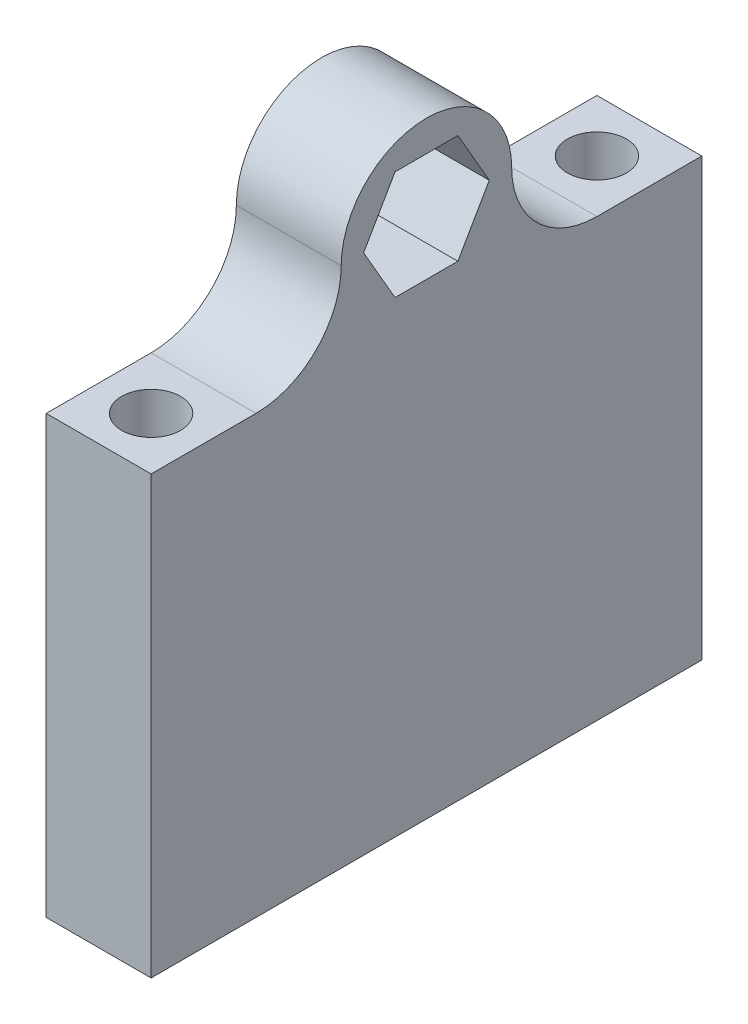
from build123d import *

# Parameters (mm, degrees)
EXTRUDE_1_DEPTH     = 8
CUT_EXTRUDE_1_DEPTH = 46.701663263
SKETCH_3_R          = 2.25
CUT_EXTRUDE_2_DEPTH = 41.169105606


with BuildPart() as part:
    # Эскиз1 → Бобышка-Вытянуть1 (new body)
    with BuildSketch(Plane(origin=(0, 0, 0), x_dir=(0, 0, -1), z_dir=(1, 0, 0))):
        with BuildLine():
            Line((-13, -6.499999697), (-21, -6.499999697))
            Line((-21, -6.499999697), (-21, -39.795))
            Line((-21, -39.795), (21, -39.795))
            Line((21, -39.795), (21, -6.499999697))
            Line((21, -6.499999697), (13, -6.499999697))
            ThreePointArc((13, -6.499999697), (8.403805976, -4.596193828), (6.5, 1.52e-07))
            ThreePointArc((6.5, 1.52e-07), (0, 6.5), (-6.5, 1.52e-07))
            ThreePointArc((-6.5, 1.52e-07), (-8.403805976, -4.596193828), (-13, -6.499999697))
        make_face()
    extrude(amount=EXTRUDE_1_DEPTH)

    # Эскиз2 → Вырез-Вытянуть1 (cut, through all)
    with BuildSketch(Plane(origin=(8, 0, 0), x_dir=(0, 0, -1), z_dir=(1, 0, 0))):
        Polygon((4.792007234, 0), (2.396003617, 4.15), (-2.396003617, 4.15), (-4.792007234, 0), (-2.396003617, -4.15), (2.396003617, -4.15), align=None)
    extrude(amount=-CUT_EXTRUDE_1_DEPTH, mode=Mode.SUBTRACT)

    # Эскиз3 → Вырез-Вытянуть2 (cut, through all)
    with BuildSketch(Plane(origin=(0, -6.499999697, 0), x_dir=(1, 0, 0), z_dir=(0, 1, 0))):
        with Locations((4, 17.001822692)):
            Circle(SKETCH_3_R)
        with Locations((4, -17.001822692)):
            Circle(SKETCH_3_R)
    extrude(amount=-CUT_EXTRUDE_2_DEPTH, mode=Mode.SUBTRACT)


solid = part.part
